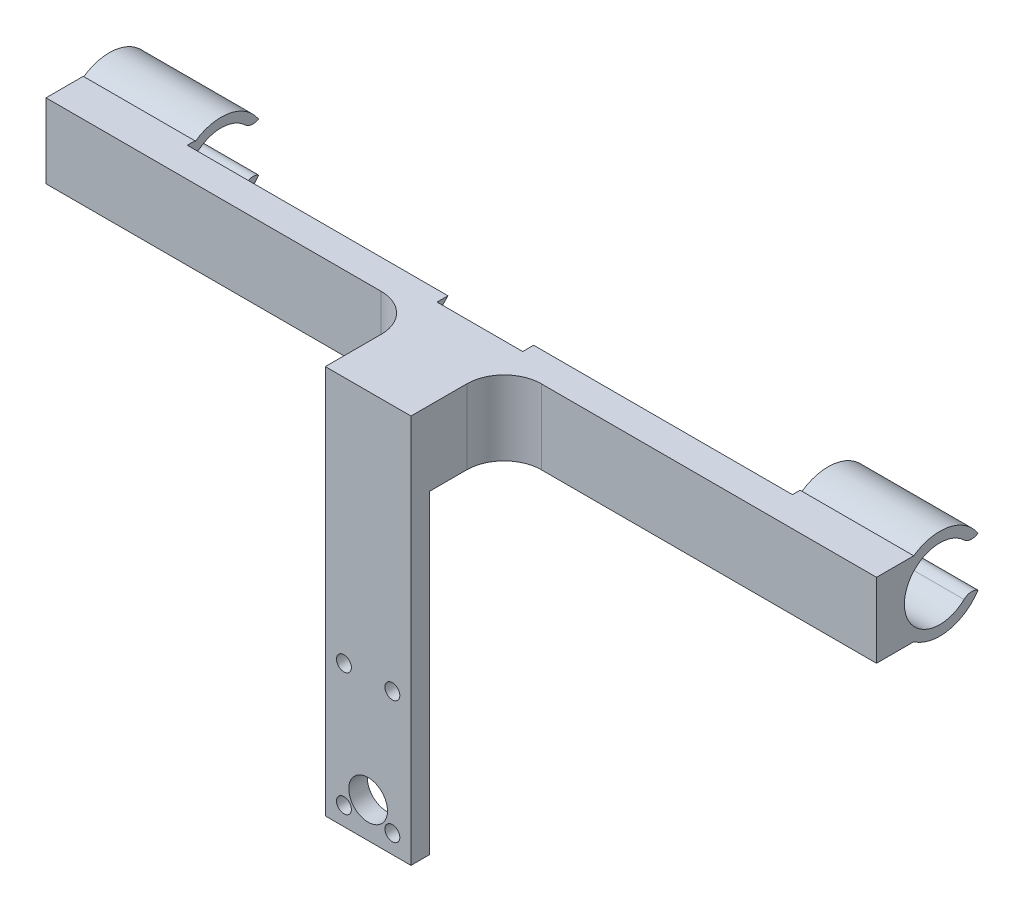
from build123d import *

# Parameters (mm, degrees)
SKETCH1_W           = 23
SKETCH1_H           = 104.5
SKETCH1_R           = 2
SKETCH1_R_2         = 5.2
BOSS_EXTRUDE1_DEPTH = 5
SKETCH2_W           = 23
SKETCH2_H           = 20
BOSS_EXTRUDE2_DEPTH = 20
SKETCH3_W           = 23
SKETCH3_H           = 20
BOSS_EXTRUDE3_DEPTH = 5
SKETCH3_3_W         = 100
SKETCH3_3_H         = 20
BOSS_EXTRUDE4_DEPTH = 10
BOSS_EXTRUDE5_DEPTH = 30
BOSS_EXTRUDE6_DEPTH = 30
FILLET1_R           = 10
CUT_EXTRUDE1_DEPTH  = 300
SKETCH6_R           = 13.5
CUT_EXTRUDE2_DEPTH  = 162.5
FILLET5_R           = 3


with BuildPart() as part:
    # Sketch1 → Boss-Extrude1 (new body)
    with BuildSketch(Plane.XY):
        with Locations((0, 30.75)):
            Rectangle(SKETCH1_W, SKETCH1_H)
        with Locations((6.5, 16.5)):
            Circle(SKETCH1_R, mode=Mode.SUBTRACT)
        with Locations((6.5, -16.5)):
            Circle(SKETCH1_R, mode=Mode.SUBTRACT)
        with Locations((0, -12)):
            Circle(SKETCH1_R_2, mode=Mode.SUBTRACT)
        with Locations((-6.5, -16.5)):
            Circle(SKETCH1_R, mode=Mode.SUBTRACT)
        with Locations((-6.5, 16.5)):
            Circle(SKETCH1_R, mode=Mode.SUBTRACT)
    extrude(amount=BOSS_EXTRUDE1_DEPTH)

    # Sketch2 → Boss-Extrude2 (add)
    with BuildSketch(Plane(origin=(0, 0, 0), x_dir=(-1, 0, 0), z_dir=(0, 0, -1))):
        with Locations((0, 73)):
            Rectangle(SKETCH2_W, SKETCH2_H)
    extrude(amount=BOSS_EXTRUDE2_DEPTH)

    # Sketch3 → Boss-Extrude3 (add)
    with BuildSketch(Plane(origin=(0, 0, -20), x_dir=(-1, 0, 0), z_dir=(0, 0, -1))):
        with Locations((0, 73)):
            Rectangle(SKETCH3_W, SKETCH3_H)
    extrude(amount=BOSS_EXTRUDE3_DEPTH)

    # Sketch3<3> → Boss-Extrude4 (add)
    with BuildSketch(Plane(origin=(0, 0, -20), x_dir=(-1, 0, 0), z_dir=(0, 0, -1))):
        with Locations((-61.5, 73)):
            Rectangle(SKETCH3_3_W, SKETCH3_3_H)
        with Locations((61.5, 73)):
            Rectangle(SKETCH3_3_W, SKETCH3_3_H)
    extrude(amount=BOSS_EXTRUDE4_DEPTH)

    # Sketch4 → Boss-Extrude5 (add)
    with BuildSketch(Plane(origin=(111.5, 0, 0), x_dir=(0, 0, -1), z_dir=(1, 0, 0))):
        with BuildLine():
            Line((30, 83), (30, 79.422616289))
            ThreePointArc((30, 79.422616289), (37.803170415, 82.465987391), (44.982034231, 78.151420148))
            Line((44.982034231, 78.151420148), (47.256120501, 79.619062793))
            ThreePointArc((47.256120501, 79.619062793), (39.346969169, 84.978803601), (30, 83))
        make_face()
        with BuildLine():
            ThreePointArc((44.982034231, 67.848579852), (37.803170415, 63.534012609), (30, 66.577383711))
            Line((30, 66.577383711), (30, 63))
            ThreePointArc((30, 63), (39.346969169, 61.021196399), (47.256120501, 66.380937207))
            Line((47.256120501, 66.380937207), (44.982034231, 67.848579852))
        make_face()
    extrude(amount=-BOSS_EXTRUDE5_DEPTH)

    # Sketch5 → Boss-Extrude6 (add)
    with BuildSketch(Plane.ZY.offset(111.5)):
        with BuildLine():
            ThreePointArc((-44.99074033, 78.15631214), (-37.806835348, 82.471571982), (-30, 79.42472441))
            Line((-30, 79.42472441), (-30, 82.742901835))
            ThreePointArc((-30, 82.742901835), (-39.236660525, 84.790740062), (-47.086393259, 79.50952476))
            Line((-47.086393259, 79.50952476), (-44.99074033, 78.15631214))
        make_face()
        with BuildLine():
            Line((-30, 63.257098165), (-30, 66.57527559))
            ThreePointArc((-30, 66.57527559), (-37.806835348, 63.528428018), (-44.99074033, 67.84368786))
            Line((-44.99074033, 67.84368786), (-47.086393259, 66.49047524))
            ThreePointArc((-47.086393259, 66.49047524), (-39.236660525, 61.209259938), (-30, 63.257098165))
        make_face()
    extrude(amount=-BOSS_EXTRUDE6_DEPTH)

    # Fillet1
    fillet1_edges = [part.edges().sort_by_distance(p)[0] for p in [
        (11.5, 73, -20),
        (-11.5, 73, -20),
    ]]
    fillet(fillet1_edges, radius=FILLET1_R)

    # Sketch4<3> → Cut-Extrude1 (cut)
    with BuildSketch(Plane(origin=(111.5, 0, 0), x_dir=(0, 0, -1), z_dir=(1, 0, 0))):
        with BuildLine():
            Line((30, 66.577383711), (30, 73))
            Line((30, 73), (27.5, 73))
            ThreePointArc((27.5, 73), (28.147034395, 69.553987812), (30, 66.577383711))
        make_face()
        with BuildLine():
            Line((27.5, 73), (30, 73))
            Line((30, 73), (30, 79.422616289))
            ThreePointArc((30, 79.422616289), (28.147034395, 76.446012188), (27.5, 73))
        make_face()
    extrude(amount=-CUT_EXTRUDE1_DEPTH, mode=Mode.SUBTRACT)

    # Sketch6 → Cut-Extrude2 (cut)
    with BuildSketch(Plane(origin=(-81.5, 0, 0), x_dir=(0, 0, -1), z_dir=(1, 0, 0))):
        with Locations((37.005416749, 73)):
            Circle(SKETCH6_R)
    extrude(amount=CUT_EXTRUDE2_DEPTH, mode=Mode.SUBTRACT)

    # Fillet5
    # the kernel refuses this fillet: 3 mm, written as the material it takes off along each edge
    with BuildSketch(Plane(origin=(118.086652749, 67.848579852, -44.982034231), x_dir=(0, -0.768500975054365, 0.6398486159557513), z_dir=(-1, 0, 0))) as fillet5_piece_1:
        with BuildLine():
            CenterArc((2.659503922, -2.977998992), FILLET5_R, 96.943270181, 76.113459637)
            Line((-0.318495069, -2.615339366), (-0.378055049, -2.608086174))
            Line((-0.378055049, -2.608086174), (-0.05955998, 0.007253193))
            Line((-0.05955998, 0.007253193), (0.007253193, 0.05955998))
            ThreePointArc((0.007253193, 0.05955998), (1.148422148, -0.009669859), (2.289591104, 0.05955998))
            Line((2.289591104, 0.05955998), (2.296844297, 0))
        make_face()
    extrude(amount=43.173305498, mode=Mode.SUBTRACT)
    with BuildSketch(Plane(origin=(-117.736458127, 67.84368786, -44.99074033), x_dir=(0, -0.5424603966463132, -0.8400813758620795), z_dir=(1, 0, 0))) as fillet5_piece_2:
        with BuildLine():
            CenterArc((2.635643587, -2.996681829), FILLET5_R, 92.695047673, 73.440207037)
            Line((-0.276948751, -2.277789714), (-0.335200598, -2.263411872))
            ThreePointArc((-0.335200598, -2.263411872), (-0.129052561, -1.140040424), (-0.06, 0))
            Line((-0.06, 0), (0, 0.06))
            ThreePointArc((0, 0.06), (1.247291625, 0.06), (2.491762044, 0.059933637))
            Line((2.491762044, 0.059933637), (2.494583251, 0))
        make_face()
    extrude(amount=42.472916254, mode=Mode.SUBTRACT)
    with BuildSketch(Plane(origin=(-117.736458127, 78.15631214, -44.99074033), x_dir=(0, 0.7684660550632233, 0.6398905548729151), z_dir=(1, 0, 0))) as fillet5_piece_3:
        with BuildLine():
            CenterArc((2.656657786, -2.978067915), FILLET5_R, 96.932372645, 73.440207037)
            Line((-0.301090552, -2.476346114), (-0.360245519, -2.466311678))
            ThreePointArc((-0.360245519, -2.466311678), (-0.210106634, -1.230931193), (-0.059561358, 0.007241864))
            Line((-0.059561358, 0.007241864), (0.007241864, 0.059561358))
            ThreePointArc((0.007241864, 0.059561358), (1.147282288, -0.009491202), (2.287322712, 0.059561358))
            Line((2.287322712, 0.059561358), (2.294564576, 0))
        make_face()
    extrude(amount=42.472916254, mode=Mode.SUBTRACT)
    with BuildSketch(Plane(origin=(118.086652749, 78.151420148, -44.982034231), x_dir=(0, 0.5422547524206679, -0.8402141295391314), z_dir=(-1, 0, 0))) as fillet5_piece_4:
        with BuildLine():
            CenterArc((2.6346611, -3), FILLET5_R, 90, 76.113459637)
            Line((-0.277657564, -2.28), (-0.335903938, -2.2656))
            ThreePointArc((-0.335903938, -2.2656), (-0.129229839, -1.141168956), (-0.06, 0))
            Line((-0.06, 0), (0, 0.06))
            Line((0, 0.06), (2.6346611, 0.06))
            Line((2.6346611, 0.06), (2.6346611, 0))
        make_face()
    extrude(amount=43.173305498, mode=Mode.SUBTRACT)


solid = part.part
